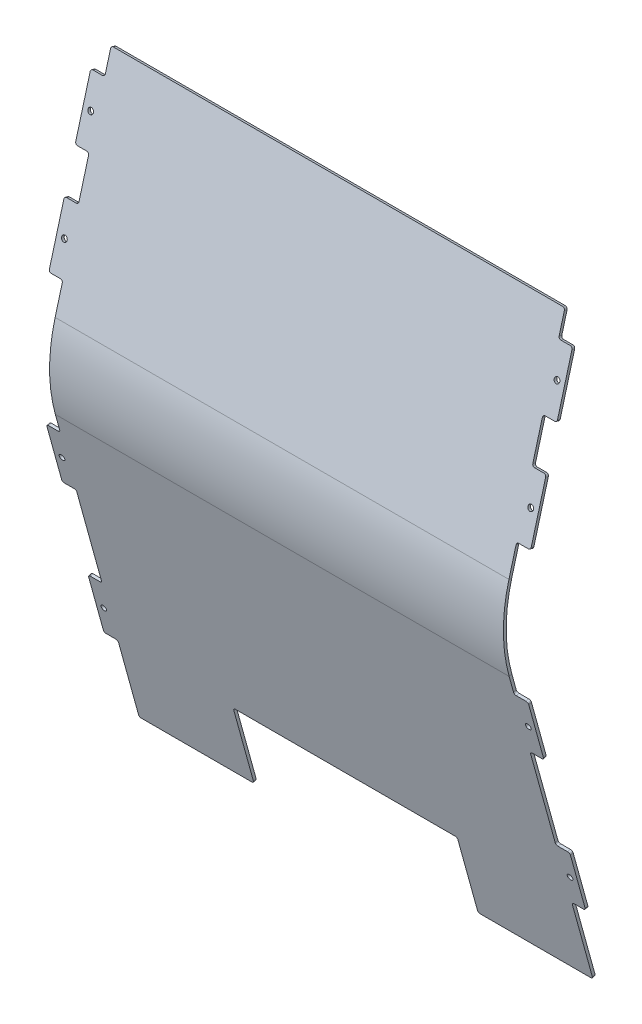
from build123d import *

# Parameters (mm, degrees)
BASE_FLANGE1_DEPTH          = 514.35
BOSS_EXTRUDE1_DEPTH         = 15.875
UNFOLD1_START               = -514.35
UNFOLD1_DEPTH               = 530.225
UNFOLD1_2_DEPTH             = 514.35
UNFOLD1_3_DEPTH             = 15.875
SKETCH10_W                  = 15.875
SKETCH10_H                  = 67.818
BOSS_EXTRUDE3_DEPTH         = 3.175
F_1_4_0_25_DIAMETER_HOLE2_D = 6.35
FOLD1_START                 = 56.527453153
FOLD1_OUTLINE_R             = 3.175
FOLD1_DEPTH                 = 21.579851663
FOLD1_START_2               = -530.225
FOLD1_2_DEPTH               = 546.1
FOLD1_START_3               = -514.35
FOLD1_3_DEPTH               = 514.35
FOLD1_START_4               = -518.287
FOLD1_4_DEPTH               = 522.2239999
FOLD1_START_5               = 10.287
FOLD1_5_DEPTH               = 5.588
FOLD1_6_DEPTH               = 5.5879999
FOLD1_7_DEPTH               = 3.175
SKETCH13_W                  = 254
SKETCH13_H                  = 88.9
CUT_EXTRUDE1_DEPTH          = 846.146615463
FILLET1_R                   = 2.54


with BuildPart() as part:
    # Base-Flange1: sheet metal written as solids
    # Sketch1 → Base-Flange1 (new body)
    with BuildSketch(Plane(origin=(0, 0, 0), x_dir=(0, 0, -1), z_dir=(1, 0, 0))):
        with BuildLine():
            Line((0, 0), (-63.5, -234.95))
            ThreePointArc((-63.5, -234.95), (-69.657800653, -281.796916986), (-63.259106615, -328.611539217))
            Line((-63.259106615, -328.611539217), (31.75, -673.1))
            Line((31.75, -673.1), (28.689272895, -673.944141331))
            Line((28.689272895, -673.944141331), (-66.31983372, -329.455680548))
            ThreePointArc((-66.31983372, -329.455680548), (-72.832790151, -281.80508292), (-66.565028773, -234.121613845))
            Line((-66.565028773, -234.121613845), (-3.065028773, 0.828386155))
            Line((-3.065028773, 0.828386155), (0, 0))
        make_face()
    extrude(amount=-BASE_FLANGE1_DEPTH)

    # Sketch6 → Boss-Extrude1 (add)
    with BuildSketch(Plane(origin=(0, 0, 0), x_dir=(0, 0, -1), z_dir=(1, 0, 0))):
        Polygon((-24.958609592, -92.346855489), (-28.023638364, -91.518469334), (-10.329310097, -26.049454745), (-7.264281324, -26.8778409), align=None)
        Polygon((-54.780511165, -202.687891312), (-57.845539938, -201.859505157), (-40.151211671, -136.390490569), (-37.086182898, -137.218876723), align=None)
        Polygon((-39.574480305, -414.488364632), (-42.635207411, -415.332505963), (-60.666066245, -349.955374995), (-57.60533914, -349.111233663), align=None)
        Polygon((7.697434241, -585.889082528), (4.636707136, -586.733223859), (-13.394151698, -521.35609289), (-10.333424593, -520.511951559), align=None)
    extrude(amount=BOSS_EXTRUDE1_DEPTH)

    # Unfold1: read off the stored shape, not the designer's step
    # Unfold1 outline → Unfold1 (cut)
    with BuildSketch(Plane.YZ.offset(UNFOLD1_START)):
        with BuildLine():
            ThreePointArc((-234.121613845, 66.565028773), (-264.853231277, 72.080888585), (-296.075563797, 72.232452052))
            Line((-296.075563797, 72.232452052), (-328.611539217, 63.259106615))
            ThreePointArc((-328.611539217, 63.259106615), (-281.796916986, 69.657800653), (-234.95, 63.5))
            Line((-234.95, 63.5), (0, 0))
            Line((0, 0), (0.828386155, 3.065028773))
            Line((0.828386155, 3.065028773), (-234.121613845, 66.565028773))
        make_face()
    extrude(amount=UNFOLD1_DEPTH, mode=Mode.SUBTRACT)

    # Unfold1 2 outline → Unfold1 2 (add)
    with BuildSketch(Plane.YZ.offset(UNFOLD1_START)):
        with BuildLine():
            Line((-1.806679071, 153.391117799), (-2.650820402, 156.451844904))
            Line((-2.650820402, 156.451844904), (-329.455680548, 66.31983372))
            ThreePointArc((-329.455680548, 66.31983372), (-312.904368973, 70.059448037), (-296.075563797, 72.232452052))
            Line((-296.075563797, 72.232452052), (-1.806679071, 153.391117799))
        make_face()
    extrude(amount=UNFOLD1_2_DEPTH)

    # Unfold1 3 outline → Unfold1 3 (add)
    with BuildSketch(Plane.YZ):
        Polygon((-28.646797801, 145.98867623), (-29.490939132, 149.049403336), (-94.868070101, 131.018544501), (-94.023928769, 127.957817396), align=None)
        Polygon((-138.832973591, 115.599588307), (-139.677114922, 118.660315413), (-205.054245891, 100.629456578), (-204.210104559, 97.568729473), align=None)
    extrude(amount=UNFOLD1_3_DEPTH)

    # Sketch10 → Boss-Extrude3 (add)
    with BuildSketch(Plane(origin=(0, -39.442188951, 143.011332762), x_dir=(-1, 0, 0), z_dir=(0, 0.26587128541416305, -0.9640085370950928))):
        with Locations((522.2875, -22.710560635)):
            Rectangle(SKETCH10_W, SKETCH10_H)
        with Locations((522.2875, -137.010560635)):
            Rectangle(SKETCH10_W, SKETCH10_H)
        with Locations((522.2875, -355.139604084)):
            Rectangle(SKETCH10_W, SKETCH10_H)
        with Locations((522.2875, -532.939604084)):
            Rectangle(SKETCH10_W, SKETCH10_H)
    extrude(amount=-BOSS_EXTRUDE3_DEPTH)

    # 1/4 (0.25) Diameter Hole2 (through all)
    with Locations(Plane(origin=(0, -39.442188951, 143.011332762), x_dir=(-1, 0, 0), z_dir=(0, 0.26587128541416305, -0.9640085370950928))):
        with Locations((-7.112, -22.710560635), (-7.112, -137.010560635), (-7.112, -355.139604084), (-7.112, -532.939604084), (521.462, -532.939604084), (521.462, -355.139604084), (521.462, -137.010560635), (521.462, -22.710560635)):
            Hole(F_1_4_0_25_DIAMETER_HOLE2_D / 2)

    # Fold1: read off the stored shape, not the designer's step
    # Fold1 outline → Fold1 (cut)
    with BuildSketch(Plane(origin=(0, 0, 0), x_dir=(1, 0, 0), z_dir=(0, 0.26090902514277503, 0.9653633930282662)).offset(FOLD1_START)):
        with Locations((-521.462, -176.051200247)):
            Circle(FOLD1_OUTLINE_R)
        with Locations((7.112, -176.051200247)):
            Circle(FOLD1_OUTLINE_R)
    extrude(amount=FOLD1_DEPTH, mode=Mode.SUBTRACT)

    # Fold1 2 outline → Fold1 2 (cut)
    with BuildSketch(Plane.YZ.offset(FOLD1_START_2)):
        with BuildLine():
            ThreePointArc((-329.455680548, 66.31983372), (-312.904368974, 70.059448037), (-296.075563798, 72.232452051))
            Line((-296.075563798, 72.232452051), (-1.806679071, 153.391117799))
            Line((-1.806679071, 153.391117799), (-2.650820402, 156.451844904))
            Line((-2.650820402, 156.451844904), (-329.455680548, 66.31983372))
        make_face()
    extrude(amount=FOLD1_2_DEPTH, mode=Mode.SUBTRACT)

    # Fold1 3 outline → Fold1 3 (add)
    with BuildSketch(Plane.YZ.offset(FOLD1_START_3)):
        with BuildLine():
            Line((0, 0), (0.828386155, 3.065028773))
            Line((0.828386155, 3.065028773), (-234.121613845, 66.565028773))
            ThreePointArc((-234.121613845, 66.565028773), (-264.853231278, 72.080888585), (-296.075563798, 72.232452051))
            Line((-296.075563798, 72.232452051), (-328.611539217, 63.259106615))
            ThreePointArc((-328.611539217, 63.259106615), (-281.796916986, 69.657800653), (-234.95, 63.5))
            Line((-234.95, 63.5), (0, 0))
        make_face()
    extrude(amount=FOLD1_3_DEPTH)

    # Fold1 4 outline → Fold1 4 (add)
    with BuildSketch(Plane.YZ.offset(FOLD1_START_4)):
        Polygon((-26.8778409, 7.264281324), (-26.049454745, 10.329310097), (-91.518469334, 28.023638365), (-92.346855489, 24.958609592), align=None)
        Polygon((-137.218876723, 37.086182898), (-136.390490569, 40.151211671), (-201.859505157, 57.845539938), (-202.687891312, 54.780511165), align=None)
    extrude(amount=FOLD1_4_DEPTH)



with BuildPart() as body_2:
    # Fold1 5 outline → Fold1 5 (new body)
    with BuildSketch(Plane.YZ.offset(FOLD1_START_5)):
        Polygon((-26.8778409, 7.264281324), (-26.049454745, 10.329310097), (-91.518469334, 28.023638365), (-92.346855489, 24.958609592), align=None)
        Polygon((-137.218876723, 37.086182898), (-136.390490569, 40.151211671), (-201.859505157, 57.845539938), (-202.687891312, 54.780511165), align=None)
    extrude(amount=FOLD1_5_DEPTH)


with BuildPart() as body_3:
    # Fold1 6 outline → Fold1 6 (new body)
    with BuildSketch(Plane.YZ.offset(FOLD1_START_2)):
        Polygon((-26.8778409, 7.264281324), (-26.049454745, 10.329310097), (-91.518469334, 28.023638365), (-92.346855489, 24.958609592), align=None)
        Polygon((-137.218876723, 37.086182898), (-136.390490569, 40.151211671), (-201.859505157, 57.845539938), (-202.687891312, 54.780511165), align=None)
    extrude(amount=FOLD1_6_DEPTH)


with BuildPart() as part_1:
    add(part.part)

    add(body_2.part)  # Fold1 7 merges body 2

    add(body_3.part)  # Fold1 7 merges body 3
    # Fold1 7 outline → Fold1 7 (add)
    with BuildSketch(Plane(origin=(0, 0, 0), x_dir=(1, 0, 0), z_dir=(0, 0.26090902514277503, 0.9653633930282662))):
        with BuildLine():
            Line((10.287, -27.842200247), (3.9369999, -27.842200247))
            Line((3.9369999, -27.842200247), (3.937, -61.751200247))
            ThreePointArc((3.937, -61.751200247), (7.112, -58.576200247), (10.287, -61.751200247))
            Line((10.287, -61.751200247), (10.287, -27.842200247))
        make_face()
        with BuildLine():
            ThreePointArc((10.287, -61.751200247), (7.112, -64.926200247), (3.937, -61.751200247))
            Line((3.937, -61.751200247), (3.9369999, -95.660200248))
            Line((3.9369999, -95.660200248), (10.287, -95.660200247))
            Line((10.287, -95.660200247), (10.287, -61.751200247))
        make_face()
        with BuildLine():
            Line((-518.287, -61.751200247), (-518.287, -27.842200247))
            Line((-518.287, -27.842200247), (-524.6370001, -27.842200247))
            Line((-524.6370001, -27.842200247), (-524.637, -61.751200247))
            ThreePointArc((-524.637, -61.751200247), (-521.462, -58.576200247), (-518.287, -61.751200247))
        make_face()
        with BuildLine():
            Line((-518.287, -95.660200248), (-518.287, -61.751200247))
            ThreePointArc((-518.287, -61.751200247), (-521.462, -64.926200247), (-524.637, -61.751200247))
            Line((-524.637, -61.751200247), (-524.6370001, -95.660200248))
            Line((-524.6370001, -95.660200248), (-518.287, -95.660200248))
        make_face()
        with BuildLine():
            Line((10.287, -142.142200247), (3.9369999, -142.142200247))
            Line((3.9369999, -142.142200247), (3.937, -176.051200247))
            ThreePointArc((3.937, -176.051200247), (7.112, -172.876200247), (10.287, -176.051200247))
            Line((10.287, -176.051200247), (10.287, -142.142200247))
        make_face()
        with BuildLine():
            ThreePointArc((10.287, -176.051200247), (7.112, -179.226200247), (3.937, -176.051200247))
            Line((3.937, -176.051200247), (3.9369999, -209.960200248))
            Line((3.9369999, -209.960200248), (10.287, -209.960200247))
            Line((10.287, -209.960200247), (10.287, -176.051200247))
        make_face()
        with BuildLine():
            Line((-518.287, -176.051200247), (-518.287, -142.142200247))
            Line((-518.287, -142.142200247), (-524.6370001, -142.142200247))
            Line((-524.6370001, -142.142200247), (-524.637, -176.051200247))
            ThreePointArc((-524.637, -176.051200247), (-521.462, -172.876200247), (-518.287, -176.051200247))
        make_face()
        with BuildLine():
            Line((-518.287, -209.960200248), (-518.287, -176.051200247))
            ThreePointArc((-518.287, -176.051200247), (-521.462, -179.226200247), (-524.637, -176.051200247))
            Line((-524.637, -176.051200247), (-524.6370001, -209.960200248))
            Line((-524.6370001, -209.960200248), (-518.287, -209.960200248))
        make_face()
    extrude(amount=FOLD1_7_DEPTH)

    # Sketch13 → Cut-Extrude1 (cut, through all)
    with BuildSketch(Plane(origin=(0, -39.442188951, 143.011332762), x_dir=(-1, 0, 0), z_dir=(0, 0.2658712854141638, -0.9640085370950925))):
        with Locations((257.175, -612.865559631)):
            Rectangle(SKETCH13_W, SKETCH13_H)
    extrude(amount=-CUT_EXTRUDE1_DEPTH, mode=Mode.SUBTRACT)

    # Fillet1
    fillet1_edges = [part_1.edges().sort_by_distance(p)[0] for p in [
        (-514.35, -26.463647823, 8.79679571),
        (-514.35, -91.932662411, 26.491123978),
        (-530.225, -91.932662412, 26.491123978),
        (-530.225, -26.463647823, 8.79679571),
        (-514.35, -136.804683646, 38.618697284),
        (-514.35, -202.273698234, 56.313025551),
        (-530.225, -202.273698234, 56.313025552),
        (-530.225, -136.804683646, 38.618697285),
        (-514.35, -349.533304329, 59.135702692),
        (-530.225, -349.533304329, 59.135702692),
        (-530.225, -414.910435298, 41.104843858),
        (-514.35, -414.910435298, 41.104843858),
        (-514.35, -520.934022224, 11.863788146),
        (-530.225, -520.934022224, 11.863788146),
        (-530.225, -586.311153193, -6.167070689),
        (-514.35, -586.311153193, -6.167070689),
        (-514.35, -673.522070666, -30.219636447),
        (0, -673.522070666, -30.219636447),
        (0, -586.311153193, -6.167070689),
        (15.875, -520.934022224, 11.863788146),
        (15.875, -586.311153193, -6.167070689),
        (0, -520.934022224, 11.863788146),
        (0, -414.910435298, 41.104843858),
        (15.875, -349.533304329, 59.135702692),
        (15.875, -414.910435298, 41.104843858),
        (0, -349.533304329, 59.135702692),
        (-514.35, 0.414193077, 1.532514386),
        (0, -26.463647823, 8.79679571),
        (0, -91.932662411, 26.491123978),
        (-130.175, -673.522070666, -30.219636447),
        (-130.175, -587.821711718, -6.583679174),
        (-384.175, -587.821711718, -6.583679174),
        (-384.175, -673.522070666, -30.219636447),
        (15.875, -26.463647823, 8.79679571),
        (15.875, -91.932662412, 26.491123978),
        (0, -136.804683646, 38.618697284),
        (0, -202.273698234, 56.313025551),
        (15.875, -136.804683646, 38.618697285),
        (15.875, -202.273698234, 56.313025552),
        (0, 0.414193077, 1.532514386),
    ]]
    fillet(fillet1_edges, radius=FILLET1_R)


solid = part_1.part
